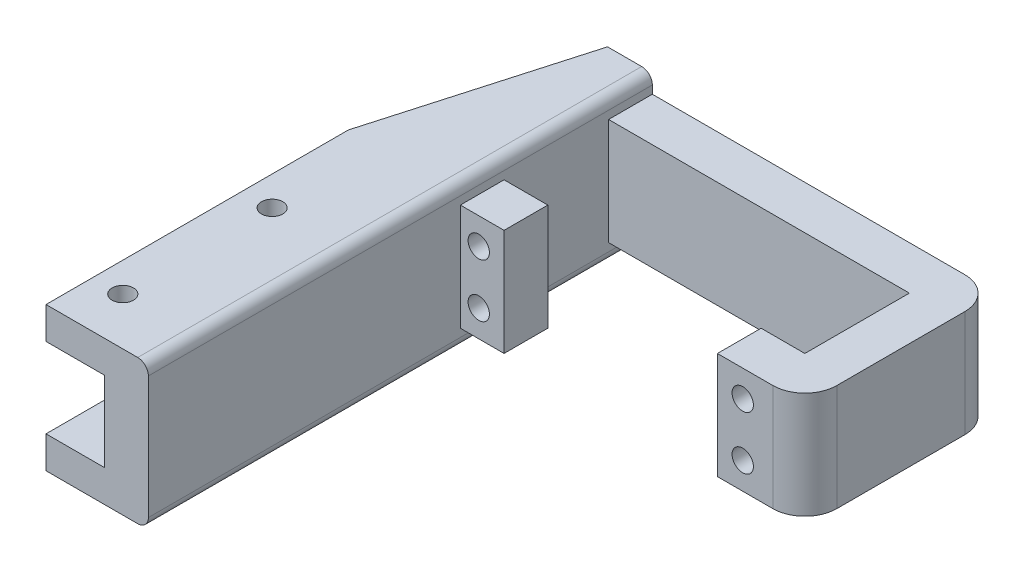
from build123d import *

# Parameters (mm, degrees)
SCHIZZO1_W                    = 64.6
SCHIZZO1_H                    = 20
ESTRUSIONE_ESTRUSIONE1_DEPTH  = 8.2
SCHIZZO2_W                    = 8.2
SCHIZZO2_H                    = 20
ESTRUSIONE_ESTRUSIONE2_DEPTH  = 27.8
SCHIZZO3_W                    = 8.2
SCHIZZO3_H                    = 20
ESTRUSIONE_ESTRUSIONE3_DEPTH  = 27.8
SCHIZZO4_W                    = 8.2
SCHIZZO4_H                    = 20
ESTRUSIONE_ESTRUSIONE4_DEPTH  = 8.2
SCHIZZO5_W                    = 36
SCHIZZO5_H                    = 20
ESTRUSIONE_ESTRUSIONE5_DEPTH  = 8.2
SCHIZZO6_W                    = 48.2
SCHIZZO6_H                    = 19.6
TAGLIO_ESTRUSIONE1_DEPTH      = 77.610443152
F_4_0_4_DIAMETER_HOLE2_D      = 4
F_4_0_4_DIAMETER_HOLE2_DEPTH  = 8.2
RACCORDO3_R                   = 6
SCHIZZO15_W                   = 8.2
SCHIZZO15_H                   = 36
ESTRUSIONE_ESTRUSIONE7_DEPTH  = 3.5
SCHIZZO16_W                   = 8.2
SCHIZZO16_H                   = 36
ESTRUSIONE_ESTRUSIONE8_DEPTH  = 3.5
SCHIZZO17_W                   = 36
SCHIZZO17_H                   = 6
ESTRUSIONE_ESTRUSIONE9_DEPTH  = 11
RACCORDO6_R                   = 2
ESTRUSIONE_ESTRUSIONE11_DEPTH = 58.5
F_4_0_4_DIAMETER_HOLE1_D      = 4
SKETCH1_W                     = 47.8
SKETCH1_H                     = 27
CUT_EXTRUDE1_DEPTH            = 11
SKETCH3_W                     = 10
SKETCH3_H                     = 27
BOSS_EXTRUDE1_DEPTH           = 11
CHAMFER1_SIZE                 = 11
CHAMFER1_SIZE_2               = 38.5


with BuildPart() as part:
    # Schizzo1 → Estrusione-Estrusione1 (new body)
    with BuildSketch(Plane.XY):
        with Locations((32.3, 10)):
            Rectangle(SCHIZZO1_W, SCHIZZO1_H)
    extrude(amount=ESTRUSIONE_ESTRUSIONE1_DEPTH)

    # Schizzo2 → Estrusione-Estrusione2 (add)
    with BuildSketch(Plane.XY.offset(8.2)):
        with Locations((4.1, 10)):
            Rectangle(SCHIZZO2_W, SCHIZZO2_H)
    extrude(amount=ESTRUSIONE_ESTRUSIONE2_DEPTH)

    # Schizzo3 → Estrusione-Estrusione3 (add)
    with BuildSketch(Plane.XY.offset(8.2)):
        with Locations((60.5, 10)):
            Rectangle(SCHIZZO3_W, SCHIZZO3_H)
    extrude(amount=ESTRUSIONE_ESTRUSIONE3_DEPTH)

    # Schizzo4 → Estrusione-Estrusione4 (add)
    with BuildSketch(Plane.ZY.offset(-56.4)):
        with Locations((31.9, 10)):
            Rectangle(SCHIZZO4_W, SCHIZZO4_H)
    extrude(amount=ESTRUSIONE_ESTRUSIONE4_DEPTH)

    # Schizzo5 → Estrusione-Estrusione5 (add)
    with BuildSketch(Plane.ZY):
        with Locations((18, 10)):
            Rectangle(SCHIZZO5_W, SCHIZZO5_H)
    extrude(amount=ESTRUSIONE_ESTRUSIONE5_DEPTH)

    # Schizzo6 → Taglio-Estrusione1 (cut, through all)
    with BuildSketch(Plane.XZ):
        with Locations((24.1, 18)):
            Rectangle(SCHIZZO6_W, SCHIZZO6_H)
    extrude(amount=-TAGLIO_ESTRUSIONE1_DEPTH, mode=Mode.SUBTRACT)

    # Ø4.0 (4) Diameter Hole2
    with Locations(Plane.XY.offset(36)):
        with Locations((52.95, 5), (3.45, 5), (3.45, 15), (52.95, 15)):
            Hole(F_4_0_4_DIAMETER_HOLE2_D / 2, depth=F_4_0_4_DIAMETER_HOLE2_DEPTH)

    # Raccordo3
    raccordo3_edges = [part.edges().sort_by_distance(p)[0] for p in [
        (64.6, 10, 36),
        (64.6, 10, 0),
    ]]
    fillet(raccordo3_edges, radius=RACCORDO3_R)

    # Schizzo15 → Estrusione-Estrusione7 (add)
    with BuildSketch(Plane.XZ):
        with Locations((-4.1, 18)):
            Rectangle(SCHIZZO15_W, SCHIZZO15_H)
    extrude(amount=ESTRUSIONE_ESTRUSIONE7_DEPTH)

    # Schizzo16 → Estrusione-Estrusione8 (add)
    with BuildSketch(Plane(origin=(0, 20, 0), x_dir=(1, 0, 0), z_dir=(0, 1, 0))):
        with Locations((-4.1, -18)):
            Rectangle(SCHIZZO16_W, SCHIZZO16_H)
    extrude(amount=ESTRUSIONE_ESTRUSIONE8_DEPTH)

    # Schizzo17 → Estrusione-Estrusione9 (add)
    with BuildSketch(Plane.ZY.offset(8.2)):
        with Locations((18, 20.5)):
            Rectangle(SCHIZZO17_W, SCHIZZO17_H)
        with Locations((18, -0.5)):
            Rectangle(SCHIZZO17_W, SCHIZZO17_H)
    extrude(amount=ESTRUSIONE_ESTRUSIONE9_DEPTH)

    # Raccordo6
    raccordo6_edges = [part.edges().sort_by_distance(p)[0] for p in [
        (0, -3.5, 18),
        (0, 23.5, 18),
    ]]
    fillet(raccordo6_edges, radius=RACCORDO6_R)

    # Schizzo24 → Estrusione-Estrusione11 (add)
    with BuildSketch(Plane.XY.offset(36)):
        with BuildLine():
            Line((-2, 23.5), (-19.2, 23.5))
            Line((-19.2, 23.5), (-19.2, 17.5))
            Line((-19.2, 17.5), (-8.2, 17.5))
            Line((-8.2, 17.5), (-8.2, 2.5))
            Line((-8.2, 2.5), (-19.2, 2.5))
            Line((-19.2, 2.5), (-19.2, -3.5))
            Line((-19.2, -3.5), (-2, -3.5))
            ThreePointArc((-2, -3.5), (-0.585786438, -2.914213562), (0, -1.5))
            Line((0, -1.5), (0, 21.5))
            ThreePointArc((0, 21.5), (-0.585786438, 22.914213562), (-2, 23.5))
        make_face()
    extrude(amount=ESTRUSIONE_ESTRUSIONE11_DEPTH)

    # Ø4.0 (4) Diameter Hole1 (through all)
    with Locations(Plane(origin=(0, -3.5, 0), x_dir=(-1, 0, 0), z_dir=(0, -1, 0))):
        with Locations((13.7, -85.6), (13.7, -57.6)):
            Hole(F_4_0_4_DIAMETER_HOLE1_D / 2)

    # Sketch1 → Cut-Extrude1 (cut)
    with BuildSketch(Plane.ZY.offset(19.2)):
        with Locations((23.9, 10)):
            Rectangle(SKETCH1_W, SKETCH1_H)
    extrude(amount=-CUT_EXTRUDE1_DEPTH, mode=Mode.SUBTRACT)

    # Sketch3 → Boss-Extrude1 (add)
    with BuildSketch(Plane.ZY.offset(8.2)):
        with Locations((42.8, 10)):
            Rectangle(SKETCH3_W, SKETCH3_H)
    extrude(amount=BOSS_EXTRUDE1_DEPTH)

    # Chamfer1
    # the kernel refuses this chamfer: 38.5, 11 mm, written as the material it adds along each edge
    with BuildSketch(Plane(origin=(-8.2, -3.5, 37.8), x_dir=(-0.9917027448815273, 0, 0.1285521909359956), z_dir=(0, 1, 0))) as chamfer1_piece_1_section:
        Polygon((CHAMFER1_SIZE * 0.991702744882, -CHAMFER1_SIZE * 0.128552190936), (-CHAMFER1_SIZE_2 * 0.128552190936, -CHAMFER1_SIZE_2 * 0.991702744882), (0, 0), align=None)
    chamfer1_piece_1 = extrude(amount=27, mode=Mode.PRIVATE)
    chamfer1_piece_1 = split(chamfer1_piece_1, bisect_by=Plane(origin=(-11.867857143, 10, 0), z_dir=(0, 0, 1)), keep=Keep.TOP, mode=Mode.PRIVATE)
    add(chamfer1_piece_1)


solid = part.part
